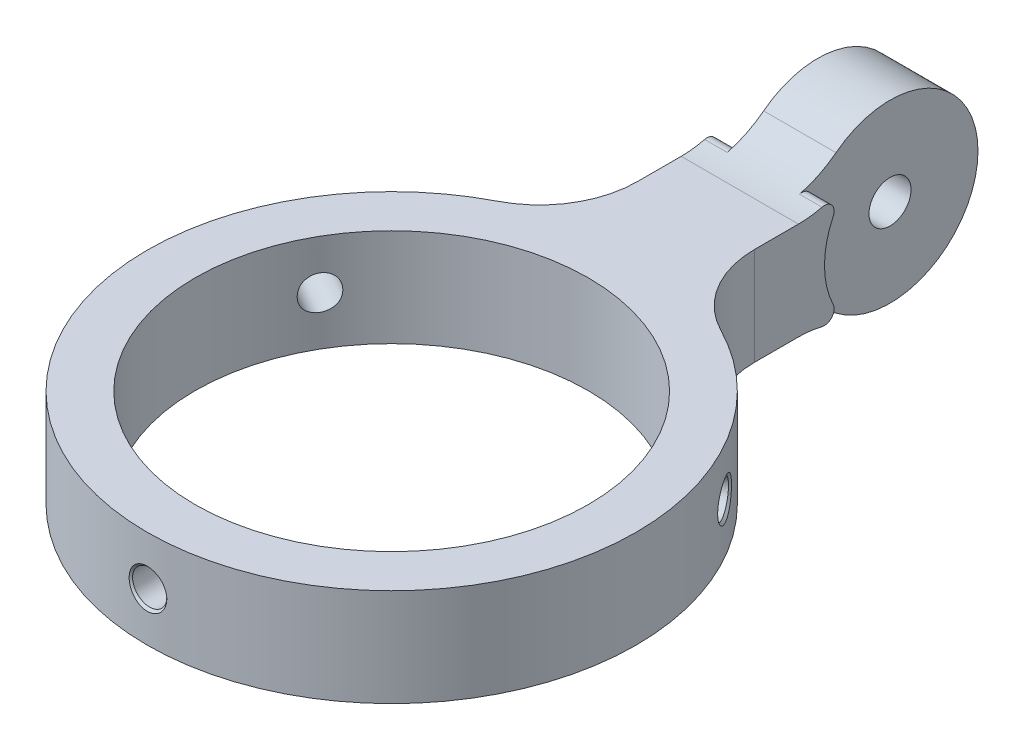
from build123d import *

# Parameters (mm, degrees)
SKETCH_1_R                      = 25
SKETCH_1_R_2                    = 20.1
EXTRUDE_1_DEPTH                 = 10
EXTRUDE_START                   = -10
EXTRUDE_2_DEPTH                 = 10
SKETCH_3_R                      = 9
EXTRUDE_3_DEPTH                 = 6
SKETCH_4_R                      = 2.15
CUT_EXTRUDE_1_DEPTH             = 66.751324099
FILLET_1_R                      = 10
SKETCH_5_R                      = 9
CUT_EXTRUDE_2_DEPTH             = 2.3
CUT_EXTRUDE_START               = -2.3
SKETCH_6_R                      = 9
CUT_EXTRUDE_3_DEPTH             = 2.3
FILLET_START                    = -6
FILLET_2_DEPTH                  = 2.3
FILLET_START_2                  = 3.7
FILLET_2_2_DEPTH                = 2.3
F_3_0MM_1_D                     = 3.5
F_3_0MM_1_DEPTH                 = 4.948493917
F_3_0MM_1_CSINK_D               = 4
F_3_0MM_1_CSINK_ANGLE           = 90
F_3_0MM_1_TIP                   = 1.051506083
F_3_0MM_1_ON_FACE_2_D           = 3.5
F_3_0MM_1_ON_FACE_2_DEPTH       = 4.948493917
F_3_0MM_1_ON_FACE_2_CSINK_D     = 4
F_3_0MM_1_ON_FACE_2_CSINK_ANGLE = 90
F_3_0MM_1_ON_FACE_2_TIP         = 1.051506083
F_3_0MM_1_ON_FACE_3_D           = 3.5
F_3_0MM_1_ON_FACE_3_DEPTH       = 4.948493917
F_3_0MM_1_ON_FACE_3_CSINK_D     = 4
F_3_0MM_1_ON_FACE_3_CSINK_ANGLE = 90
F_3_0MM_1_ON_FACE_3_TIP         = 1.051506083


with BuildPart() as part:
    # 草图1 → 凸台-拉伸1 (new body)
    with BuildSketch(Plane(origin=(0, 0, 0), x_dir=(1, 0, 0), z_dir=(0, 1, 0))):
        with Locations(Location((0, 0, 0), (0, 0, 270))):
            Circle(SKETCH_1_R)
        with Locations(Location((0, 0, 0), (0, 0, 270))):
            Circle(SKETCH_1_R_2, mode=Mode.SUBTRACT)
    extrude(amount=EXTRUDE_1_DEPTH)

    # 草图2 → 凸台-拉伸2 (add)
    with BuildSketch(Plane(origin=(0, 10, 0), x_dir=(1, 0, 0), z_dir=(0, 1, 0)).offset(EXTRUDE_START)):
        with BuildLine():
            Line((-6, 24.269322199), (-6, 40.269322199))
            Line((-6, 40.269322199), (6, 40.269322199))
            Line((6, 40.269322199), (6, 24.269322199))
            ThreePointArc((6, 24.269322199), (0, 25), (-6, 24.269322199))
        make_face()
    extrude(amount=EXTRUDE_2_DEPTH)

    # 草图3 → 凸台-拉伸3 (add, symmetric)
    with BuildSketch(Plane(origin=(0, 0, 0), x_dir=(0, 0, -1), z_dir=(1, 0, 0))):
        with Locations((47.269322199, 5)):
            Circle(SKETCH_3_R)
    extrude(amount=EXTRUDE_3_DEPTH, both=True)

    # 草图4 → 切除-拉伸1 (cut, through all)
    with BuildSketch(Plane(origin=(6, 0, 0), x_dir=(0, 0, -1), z_dir=(1, 0, 0))):
        with Locations((47.269322199, 5)):
            Circle(SKETCH_4_R)
    extrude(amount=-CUT_EXTRUDE_1_DEPTH, mode=Mode.SUBTRACT)

    # 圆角1
    fillet_1_edges = [part.edges().sort_by_distance(p)[0] for p in [
        (6, 5, -24.269322199),
        (-6, 5, -24.269322199),
        (0, 10, -39.786007425),
        (0, 0, -39.786007425),
    ]]
    fillet(fillet_1_edges, radius=FILLET_1_R)

    # 草图5 → 切除-拉伸2 (cut)
    with BuildSketch(Plane(origin=(6, 0, 0), x_dir=(0, 0, -1), z_dir=(1, 0, 0))):
        with Locations((47.269322199, 5)):
            Circle(SKETCH_5_R)
    extrude(amount=-CUT_EXTRUDE_2_DEPTH, mode=Mode.SUBTRACT)

    # 草图6 → 切除-拉伸3 (cut)
    with BuildSketch(Plane.ZY.offset(6).offset(CUT_EXTRUDE_START)):
        with Locations((-47.269322199, 5)):
            Circle(SKETCH_6_R)
    extrude(amount=CUT_EXTRUDE_3_DEPTH, mode=Mode.SUBTRACT)

    # 圆角2: read off the stored shape, not the designer's step
    # 圆角2 outline → 圆角2 (cut)
    with BuildSketch(Plane.YZ.offset(FILLET_START)):
        with BuildLine():
            ThreePointArc((10.29326278, -38.011426009), (9.953936392, -39.027326957), (8.890330152, -39.153576312))
            ThreePointArc((8.890330152, -39.153576312), (10.648449114, -40.262538157), (12.105263158, -41.745262509))
            ThreePointArc((12.105263158, -41.745262509), (11.003425316, -39.973382673), (10.29326278, -38.011426009))
        make_face()
        with BuildLine():
            ThreePointArc((-2.105263158, -41.745262509), (-0.648449114, -40.262538157), (1.109669848, -39.153576312))
            ThreePointArc((1.109669848, -39.153576312), (0.046063608, -39.027326957), (-0.29326278, -38.011426009))
            ThreePointArc((-0.29326278, -38.011426009), (-1.003425316, -39.973382673), (-2.105263158, -41.745262509))
        make_face()
    extrude(amount=FILLET_2_DEPTH, mode=Mode.SUBTRACT)

    # Fillet 2 2 outline → Fillet 2 2 (cut)
    with BuildSketch(Plane.YZ.offset(FILLET_START_2)):
        with BuildLine():
            ThreePointArc((10.29326278, -38.011426009), (9.953936392, -39.027326957), (8.890330152, -39.153576312))
            ThreePointArc((8.890330152, -39.153576312), (10.648449114, -40.262538157), (12.105263158, -41.745262509))
            ThreePointArc((12.105263158, -41.745262509), (11.003425316, -39.973382673), (10.29326278, -38.011426009))
        make_face()
        with BuildLine():
            ThreePointArc((-2.105263158, -41.745262509), (-0.648449114, -40.262538157), (1.109669848, -39.153576312))
            ThreePointArc((1.109669848, -39.153576312), (0.046063608, -39.027326957), (-0.29326278, -38.011426009))
            ThreePointArc((-0.29326278, -38.011426009), (-1.003425316, -39.973382673), (-2.105263158, -41.745262509))
        make_face()
    extrude(amount=FILLET_2_2_DEPTH, mode=Mode.SUBTRACT)

    # Ø3.0mm 暗销孔1
    with Locations(Plane(origin=(0, 5, 25), x_dir=(1, 0, 0), z_dir=(0, 0, 1))):
        with Locations((0, 0)):
            CounterSinkHole(F_3_0MM_1_D / 2, F_3_0MM_1_CSINK_D / 2, depth=F_3_0MM_1_DEPTH, counter_sink_angle=F_3_0MM_1_CSINK_ANGLE)
            with Locations((0, 0, -(F_3_0MM_1_DEPTH + F_3_0MM_1_TIP / 2))):  # 118° drill point
                Cone(0, F_3_0MM_1_D / 2, F_3_0MM_1_TIP, mode=Mode.SUBTRACT)

    # Ø3.0mm 暗销孔1 on face 2
    with Locations(Plane(origin=(-21.650635095, 5, -12.5), x_dir=(0.500000174844, 0, -0.866025302838), z_dir=(-0.866025302838, 0, -0.500000174844))):
        with Locations((0, 0)):
            CounterSinkHole(F_3_0MM_1_ON_FACE_2_D / 2, F_3_0MM_1_ON_FACE_2_CSINK_D / 2, depth=F_3_0MM_1_ON_FACE_2_DEPTH, counter_sink_angle=F_3_0MM_1_ON_FACE_2_CSINK_ANGLE)
            with Locations((0, 0, -(F_3_0MM_1_ON_FACE_2_DEPTH + F_3_0MM_1_ON_FACE_2_TIP / 2))):  # 118° drill point
                Cone(0, F_3_0MM_1_ON_FACE_2_D / 2, F_3_0MM_1_ON_FACE_2_TIP, mode=Mode.SUBTRACT)

    # Ø3.0mm 暗销孔1 on face 3
    with Locations(Plane(origin=(21.650635095, 5, -12.5), x_dir=(0.500000174844, 0, 0.866025302838), z_dir=(0.866025302838, 0, -0.500000174844))):
        with Locations((0, 0)):
            CounterSinkHole(F_3_0MM_1_ON_FACE_3_D / 2, F_3_0MM_1_ON_FACE_3_CSINK_D / 2, depth=F_3_0MM_1_ON_FACE_3_DEPTH, counter_sink_angle=F_3_0MM_1_ON_FACE_3_CSINK_ANGLE)
            with Locations((0, 0, -(F_3_0MM_1_ON_FACE_3_DEPTH + F_3_0MM_1_ON_FACE_3_TIP / 2))):  # 118° drill point
                Cone(0, F_3_0MM_1_ON_FACE_3_D / 2, F_3_0MM_1_ON_FACE_3_TIP, mode=Mode.SUBTRACT)


solid = part.part
